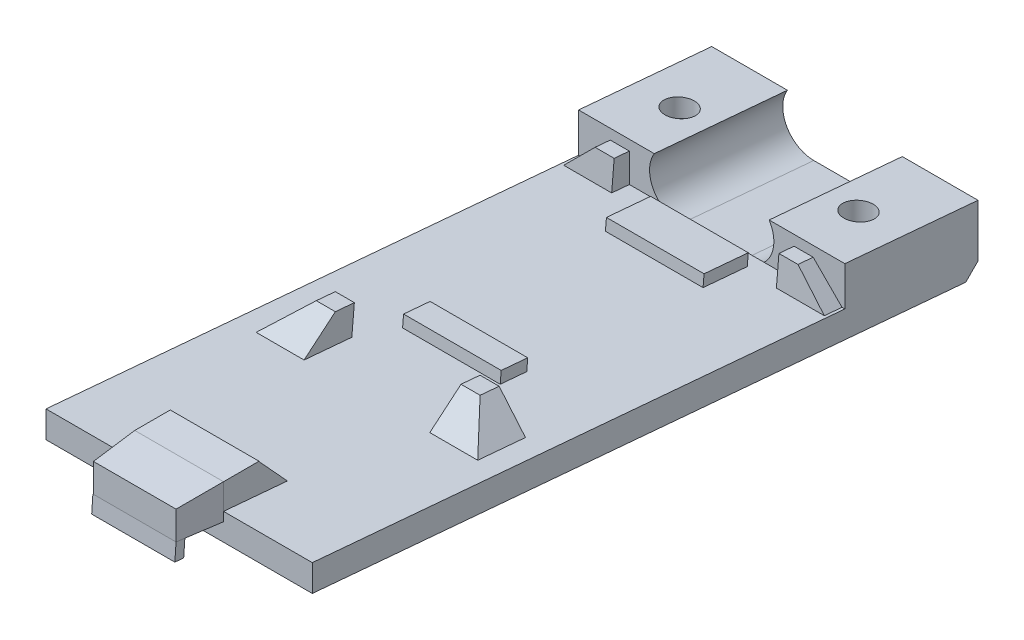
from build123d import *

# Parameters (mm, degrees)
BOSS_EXTRUDE2_DEPTH = 30
CUT_EXTRUDE1_REACH  = 197.235
CUT_EXTRUDE2_START  = 7
SKETCH6_R           = 2.85
CUT_EXTRUDE2_DEPTH  = 201.285862098
SKETCH7_R           = 1.65
CUT_EXTRUDE3_DEPTH  = 209.121088475
SKETCH9_W           = 10
SKETCH9_H           = 5.906967626
BOSS_EXTRUDE4_DEPTH = 4
SKETCH10_W          = 10
SKETCH10_H          = 3.906967626
BOSS_EXTRUDE5_DEPTH = 5
BOSS_EXTRUDE5_TAPER = 4
FILLET1_SIZE        = 3.5
CUT_EXTRUDE4_START  = -0.25
CUT_EXTRUDE4_DEPTH  = 0.25
SKETCH12_W          = 3.3
SKETCH12_H          = 3.3
CUT_EXTRUDE5_DEPTH  = 0.25
SKETCH13_W          = 2
SKETCH13_H          = 2
BOSS_EXTRUDE6_DEPTH = 3.25
BOSS_EXTRUDE7_REACH = 209.762
SKETCH14_W          = 9.370488354
SKETCH14_H          = 1
SKETCH17_W          = 11
SKETCH17_H          = 5
SKETCH17_H_2        = 3
BOSS_EXTRUDE8_DEPTH = 1.3


with BuildPart() as part:
    # Sketch2 → Boss-Extrude2 (new body)
    with BuildSketch(Plane(origin=(148.792269218, 0, 0), x_dir=(0, 0, -1), z_dir=(1, 0, 0))):
        Polygon((89.155083501, -18.22802064), (89.155083501, -22.644827925), (29.155083501, -17.395508114), (29.155083501, -20.406967626), (102.775758778, -26.847942114), (104.155083501, -25.468617391), (104.155083501, -19.540350593), align=None)
    extrude(amount=BOSS_EXTRUDE2_DEPTH)

    # Cut-Extrude1: up to this plane
    cut_extrude1_end = Plane(origin=(254.385579164, -18.22802064, -89.155083501), z_dir=(0, 0, -1))
    # Sketch4 → Cut-Extrude1 (cut, up to the surface)
    with BuildSketch(Plane(origin=(0, -9.236632985, -105.575198123), x_dir=(-1, 0, 0), z_dir=(0, -0.0871557427476512, -0.9961946980917462)), mode=Mode.PRIVATE) as cut_extrude1_sk1:
        with BuildLine():
            Line((-167.292269218, -8.738279996), (-160.292269218, -8.738279996))
            ThreePointArc((-160.292269218, -8.738279996), (-156.792269218, -12.238279996), (-160.292269218, -15.738279996))
            Line((-160.292269218, -15.738279996), (-167.292269218, -15.738279996))
            ThreePointArc((-167.292269218, -15.738279996), (-170.792269218, -12.238279996), (-167.292269218, -8.738279996))
        make_face()
    cut_extrude1_tool1 = split(extrude(cut_extrude1_sk1.sketch, amount=-CUT_EXTRUDE1_REACH, mode=Mode.PRIVATE), bisect_by=cut_extrude1_end, keep=Keep.BOTH, mode=Mode.PRIVATE)
    add(cut_extrude1_tool1.solids().sort_by_distance((163.792269, -21.428343, -104.508562))[0], mode=Mode.SUBTRACT)

    # Sketch6 → Cut-Extrude2 (cut, through all)
    with BuildSketch(Plane(origin=(0, -14.5, 0), x_dir=(-1, 0, 0), z_dir=(0, -1, 0)).offset(CUT_EXTRUDE2_START)):
        with Locations(Location((-173.869198237, 95.613531365, 0), (0, 0, 270))):
            Circle(SKETCH6_R)
        with Locations(Location((-153.7153402, 95.613531365, 0), (0, 0, 270))):
            Circle(SKETCH6_R)
    extrude(amount=CUT_EXTRUDE2_DEPTH, mode=Mode.SUBTRACT)

    # Sketch7 → Cut-Extrude3 (cut, through all)
    with BuildSketch(Plane(origin=(0, -4.5, 0), x_dir=(1, 0, 0), z_dir=(0, 1, 0))):
        with Locations(Location((173.869198237, 95.613531365, 0), (0, 0, 270))):
            Circle(SKETCH7_R)
        with Locations(Location((153.7153402, 95.613531365, 0), (0, 0, 270))):
            Circle(SKETCH7_R)
    extrude(amount=-CUT_EXTRUDE3_DEPTH, mode=Mode.SUBTRACT)

    # Sketch9 → Boss-Extrude4 (add)
    with BuildSketch(Plane.XY.offset(-29.155083501)):
        with Locations((163.792269218, -17.453483813)):
            Rectangle(SKETCH9_W, SKETCH9_H)
    extrude(amount=-BOSS_EXTRUDE4_DEPTH)

    # Sketch10 → Boss-Extrude5 (add)
    with BuildSketch(Plane.XY.offset(-29.155083501)):
        with Locations((163.792269218, -16.453483813)):
            Rectangle(SKETCH10_W, SKETCH10_H)
    extrude(amount=BOSS_EXTRUDE5_DEPTH, taper=BOSS_EXTRUDE5_TAPER)

    # Fillet1
    # the kernel refuses this chamfer: 3.5 mm, written as the material it adds along each edge
    with BuildSketch(Plane(origin=(158.792269218, -17.745462768, -33.155083501), x_dir=(0, -0.11557140669619721, -0.9932991744455757), z_dir=(1, 0, 0))) as fillet1_piece_1:
        Polygon((FILLET1_SIZE * 0.915957386947, FILLET1_SIZE * 0.0261703223739), (-FILLET1_SIZE * 0.105901682781, FILLET1_SIZE * 0.91019099867), (0, 0), align=None)
    extrude(amount=10)

    # Sketch11 → Cut-Extrude4 (cut)
    with BuildSketch(Plane.XZ.offset(21.5).offset(CUT_EXTRUDE4_START)):
        with BuildLine():
            Line((171.545408229, -97.263531365), (176.192988244, -97.263531365))
            ThreePointArc((176.192988244, -97.263531365), (176.719198237, -95.613531365), (176.192988244, -93.963531365))
            Line((176.192988244, -93.963531365), (171.545408229, -93.963531365))
            ThreePointArc((171.545408229, -93.963531365), (171.019198237, -95.613531365), (171.545408229, -97.263531365))
        make_face()
    cut_extrude4 = extrude(amount=CUT_EXTRUDE4_DEPTH, mode=Mode.SUBTRACT)

    # Sketch12 → Cut-Extrude5 (cut)
    with BuildSketch(Plane.XZ.offset(21.25)):
        with Locations((173.869198237, -95.613531365)):
            Rectangle(SKETCH12_W, SKETCH12_H)
    cut_extrude5 = extrude(amount=-CUT_EXTRUDE5_DEPTH, mode=Mode.SUBTRACT)

    # Mirror1: Cut-Extrude4, Cut-Extrude5 across plane
    add(cut_extrude4.mirror(Plane(origin=(163.792269218, 0, 0), x_dir=(0, 0, 1), z_dir=(1, 0, 0))), mode=Mode.SUBTRACT)
    add(cut_extrude5.mirror(Plane(origin=(163.792269218, 0, 0), x_dir=(0, 0, 1), z_dir=(1, 0, 0))), mode=Mode.SUBTRACT)

    # Sketch13 → Boss-Extrude6 (add)
    with BuildSketch(Plane(origin=(0, -14.732006126, 1.288883527), x_dir=(1, 0, 0), z_dir=(0, 0.9961946980917463, -0.08715574274765082))):
        with Locations((171.872269218, 56.19771425)):
            Rectangle(SKETCH13_W, SKETCH13_H)
        with Locations((174.072269218, 89.789448289)):
            Rectangle(SKETCH13_W, SKETCH13_H)
    boss_extrude6 = extrude(amount=BOSS_EXTRUDE6_DEPTH)

    # Chamfer1
    # the kernel refuses this chamfer: 3.4 mm, written as the material it adds along each edge
    with BuildSketch(Plane(origin=(170.872269218, -19.542803909, -53.698786756), x_dir=(0, 0.059731544136399986, 0.9982144772718343), z_dir=(1, 0, 0))) as chamfer1_piece_1_section:
        with BuildLine():
            Line((3.497488864, 0), (-0.192260327, -3.492200498))
            Line((-0.192260327, -3.492200498), (-0.260234617, -3.490330778))
            ThreePointArc((-0.260234617, -3.490330778), (-0.116039372, -1.745552621), (-0.06797429, 0.00186972))
            Line((-0.06797429, 0.00186972), (0.00186972, 0.06797429))
            ThreePointArc((0.00186972, 0.06797429), (1.74929206, 0.019909209), (3.499358583, 0.06797429))
            Line((3.499358583, 0.06797429), (3.497488864, 0))
        make_face()
    chamfer1_piece_1 = extrude(amount=2, mode=Mode.PRIVATE)
    chamfer1_piece_1 = split(chamfer1_piece_1, bisect_by=Plane(origin=(171.872269218, -16.206722557, -52.85677046), z_dir=(0, -0.9961946980917463, 0.08715574274765082)), keep=Keep.TOP, mode=Mode.PRIVATE)
    add(chamfer1_piece_1)
    with BuildSketch(Plane(origin=(172.872269218, -19.542803909, -53.698786756), x_dir=(0.999621916911297, -0.027391246498838125, 0.002396423548492289), z_dir=(0, -0.08715574274765082, -0.9961946980917463))) as chamfer1_piece_2_section:
        with BuildLine():
            Line((3.497488864, 0), (-0.192260327, -3.492200498))
            Line((-0.192260327, -3.492200498), (-0.260234617, -3.490330778))
            ThreePointArc((-0.260234617, -3.490330778), (-0.116039372, -1.745552621), (-0.06797429, 0.00186972))
            Line((-0.06797429, 0.00186972), (0.00186972, 0.06797429))
            ThreePointArc((0.00186972, 0.06797429), (1.74929206, 0.019909209), (3.499358583, 0.06797429))
            Line((3.499358583, 0.06797429), (3.497488864, 0))
        make_face()
    chamfer1_piece_2 = extrude(amount=2, mode=Mode.PRIVATE)
    chamfer1_piece_2 = split(chamfer1_piece_2, bisect_by=Plane(origin=(174.001840036, -16.392326883, -54.978237618), z_dir=(0, -0.9961946980917463, 0.08715574274765082)), keep=Keep.TOP, mode=Mode.PRIVATE)
    add(chamfer1_piece_2)
    with BuildSketch(Plane(origin=(175.072269218, -22.47051644, -87.162694105), x_dir=(0.9996219169112963, -0.027391246498863667, 0.0023964235484945228), z_dir=(0, -0.08715574274765082, -0.9961946980917463))) as chamfer1_piece_3_section:
        with BuildLine():
            Line((3.497488864, 0), (-0.192260327, -3.492200498))
            Line((-0.192260327, -3.492200498), (-0.260234617, -3.490330778))
            ThreePointArc((-0.260234617, -3.490330778), (-0.116039372, -1.745552621), (-0.06797429, 0.00186972))
            Line((-0.06797429, 0.00186972), (0.00186972, 0.06797429))
            ThreePointArc((0.00186972, 0.06797429), (1.74929206, 0.019909209), (3.499358583, 0.06797429))
            Line((3.499358583, 0.06797429), (3.497488864, 0))
        make_face()
    chamfer1_piece_3 = extrude(amount=10.743722159, mode=Mode.PRIVATE)
    chamfer1_piece_3 = split(chamfer1_piece_3, bisect_by=Plane(origin=(176.219153997, -21.484451045, -89.155083501), z_dir=(0, 0, 1)), keep=Keep.TOP, mode=Mode.PRIVATE)
    chamfer1_piece_3 = split(chamfer1_piece_3, bisect_by=Plane(origin=(176.219153997, -19.315947713, -88.395376614), z_dir=(0, -0.9961946980917463, 0.08715574274765082)), keep=Keep.TOP, mode=Mode.PRIVATE)
    add(chamfer1_piece_3)
    with BuildSketch(Plane(origin=(172.872269218, -18.78073831, -44.988337099), x_dir=(0.9996219169112966, -0.027391246498851222, 0.0023964235484934342), z_dir=(0, -0.08715574274765082, -0.9961946980917463))) as chamfer1_piece_4a_section:
        with BuildLine():
            Line((3.497488864, 0), (-0.192260327, -3.492200498))
            Line((-0.192260327, -3.492200498), (-0.260234617, -3.490330778))
            ThreePointArc((-0.260234617, -3.490330778), (-0.116039372, -1.745552621), (-0.06797429, 0.00186972))
            Line((-0.06797429, 0.00186972), (0.00186972, 0.06797429))
            ThreePointArc((0.00186972, 0.06797429), (1.74929206, 0.019909209), (3.499358583, 0.06797429))
            Line((3.499358583, 0.06797429), (3.497488864, 0))
        make_face()
    chamfer1_piece_4a = extrude(amount=10.743722159, mode=Mode.PRIVATE)
    chamfer1_piece_4a = split(chamfer1_piece_4a, bisect_by=Plane(origin=(174.001840036, -18.441436891, -53.795143884), z_dir=(0, 0.08715574274765084, 0.9961946980917462)), keep=Keep.TOP, mode=Mode.PRIVATE)
    chamfer1_piece_4a = split(chamfer1_piece_4a, bisect_by=Plane(origin=(174.001840036, -15.924138341, -49.626818091), z_dir=(0, -0.9961946980917463, 0.08715574274765082)), keep=Keep.TOP, mode=Mode.PRIVATE)
    with BuildSketch(Plane(origin=(170.872269218, -19.542803909, -53.698786756), x_dir=(0, 0.059731544136399986, 0.9982144772718343), z_dir=(1, 0, 0))) as chamfer1_piece_4b_section:
        with BuildLine():
            Line((3.497488864, 0), (-0.192260327, -3.492200498))
            Line((-0.192260327, -3.492200498), (-0.260234617, -3.490330778))
            ThreePointArc((-0.260234617, -3.490330778), (-0.116039372, -1.745552621), (-0.06797429, 0.00186972))
            Line((-0.06797429, 0.00186972), (0.00186972, 0.06797429))
            ThreePointArc((0.00186972, 0.06797429), (1.74929206, 0.019909209), (3.499358583, 0.06797429))
            Line((3.499358583, 0.06797429), (3.497488864, 0))
        make_face()
    chamfer1_piece_4b = extrude(amount=10.743722159, mode=Mode.PRIVATE)
    chamfer1_piece_4b = split(chamfer1_piece_4b, bisect_by=Plane(origin=(178.792269218, -18.342988307, -52.669871424), z_dir=(-1, 0, 0)), keep=Keep.TOP, mode=Mode.PRIVATE)
    chamfer1_piece_4b = split(chamfer1_piece_4b, bisect_by=Plane(origin=(172.872269218, -18.342988307, -52.669871424), z_dir=(1, 0, 0)), keep=Keep.TOP, mode=Mode.PRIVATE)
    chamfer1_piece_4b = split(chamfer1_piece_4b, bisect_by=Plane(origin=(175.832269218, -16.206722557, -52.85677046), z_dir=(0, -0.9961946980917463, 0.08715574274765082)), keep=Keep.TOP, mode=Mode.PRIVATE)
    chamfer1_piece_4 = chamfer1_piece_4a & chamfer1_piece_4b
    add(chamfer1_piece_4)

    # Mirror2: Boss-Extrude6 across plane
    add(boss_extrude6.mirror(Plane(origin=(163.792269218, 0, 0), x_dir=(0, 0, 1), z_dir=(1, 0, 0))))

    # Chamfer1 of Mirror2
    # the kernel refuses this chamfer: 3.4 mm, written as the material it adds along each edge
    with BuildSketch(Plane(origin=(156.712269218, -19.542803909, -53.698786756), x_dir=(0, 0.05973154413639897, 0.9982144772718343), z_dir=(-1, 0, 0))) as chamfer1_of_mirror2_piece_1_section:
        with BuildLine():
            Line((3.497488864, 0), (-0.192260327, 3.492200498))
            Line((-0.192260327, 3.492200498), (-0.260234617, 3.490330778))
            ThreePointArc((-0.260234617, 3.490330778), (-0.116039372, 1.745552621), (-0.06797429, -0.00186972))
            Line((-0.06797429, -0.00186972), (0.00186972, -0.06797429))
            ThreePointArc((0.00186972, -0.06797429), (1.74929206, -0.019909209), (3.499358583, -0.06797429))
            Line((3.499358583, -0.06797429), (3.497488864, 0))
        make_face()
    chamfer1_of_mirror2_piece_1 = extrude(amount=2, mode=Mode.PRIVATE)
    chamfer1_of_mirror2_piece_1 = split(chamfer1_of_mirror2_piece_1, bisect_by=Plane(origin=(155.712269218, -16.206722557, -52.85677046), z_dir=(0, -0.9961946980917463, 0.08715574274765082)), keep=Keep.TOP, mode=Mode.PRIVATE)
    add(chamfer1_of_mirror2_piece_1)
    with BuildSketch(Plane(origin=(154.712269218, -19.542803909, -53.698786756), x_dir=(-0.999621916911297, -0.027391246498838125, 0.002396423548492289), z_dir=(0, -0.08715574274765082, -0.9961946980917463))) as chamfer1_of_mirror2_piece_2_section:
        with BuildLine():
            Line((3.497488864, 0), (-0.192260327, 3.492200498))
            Line((-0.192260327, 3.492200498), (-0.260234617, 3.490330778))
            ThreePointArc((-0.260234617, 3.490330778), (-0.116039372, 1.745552621), (-0.06797429, -0.00186972))
            Line((-0.06797429, -0.00186972), (0.00186972, -0.06797429))
            ThreePointArc((0.00186972, -0.06797429), (1.74929206, -0.019909209), (3.499358583, -0.06797429))
            Line((3.499358583, -0.06797429), (3.497488864, 0))
        make_face()
    chamfer1_of_mirror2_piece_2 = extrude(amount=2, mode=Mode.PRIVATE)
    chamfer1_of_mirror2_piece_2 = split(chamfer1_of_mirror2_piece_2, bisect_by=Plane(origin=(153.582698401, -16.392326883, -54.978237618), z_dir=(0, -0.9961946980917463, 0.08715574274765082)), keep=Keep.TOP, mode=Mode.PRIVATE)
    add(chamfer1_of_mirror2_piece_2)
    with BuildSketch(Plane(origin=(152.512269218, -22.47051644, -87.162694105), x_dir=(-0.9996219169112963, -0.027391246498863667, 0.0023964235484945228), z_dir=(0, -0.08715574274765082, -0.9961946980917463))) as chamfer1_of_mirror2_piece_3_section:
        with BuildLine():
            Line((3.497488864, 0), (-0.192260327, 3.492200498))
            Line((-0.192260327, 3.492200498), (-0.260234617, 3.490330778))
            ThreePointArc((-0.260234617, 3.490330778), (-0.116039372, 1.745552621), (-0.06797429, -0.00186972))
            Line((-0.06797429, -0.00186972), (0.00186972, -0.06797429))
            ThreePointArc((0.00186972, -0.06797429), (1.74929206, -0.019909209), (3.499358583, -0.06797429))
            Line((3.499358583, -0.06797429), (3.497488864, 0))
        make_face()
    chamfer1_of_mirror2_piece_3 = extrude(amount=10.743722159, mode=Mode.PRIVATE)
    chamfer1_of_mirror2_piece_3 = split(chamfer1_of_mirror2_piece_3, bisect_by=Plane(origin=(151.365384439, -21.484451045, -89.155083501), z_dir=(0, 0, 1)), keep=Keep.TOP, mode=Mode.PRIVATE)
    chamfer1_of_mirror2_piece_3 = split(chamfer1_of_mirror2_piece_3, bisect_by=Plane(origin=(151.365384439, -19.315947713, -88.395376614), z_dir=(0, -0.9961946980917463, 0.08715574274765082)), keep=Keep.TOP, mode=Mode.PRIVATE)
    add(chamfer1_of_mirror2_piece_3)
    with BuildSketch(Plane(origin=(156.712269218, -19.542803909, -53.698786756), x_dir=(0, 0.05973154413639897, 0.9982144772718343), z_dir=(-1, 0, 0))) as chamfer1_of_mirror2_piece_4a_section:
        with BuildLine():
            Line((3.497488864, 0), (-0.192260327, 3.492200498))
            Line((-0.192260327, 3.492200498), (-0.260234617, 3.490330778))
            ThreePointArc((-0.260234617, 3.490330778), (-0.116039372, 1.745552621), (-0.06797429, -0.00186972))
            Line((-0.06797429, -0.00186972), (0.00186972, -0.06797429))
            ThreePointArc((0.00186972, -0.06797429), (1.74929206, -0.019909209), (3.499358583, -0.06797429))
            Line((3.499358583, -0.06797429), (3.497488864, 0))
        make_face()
    chamfer1_of_mirror2_piece_4a = extrude(amount=10.743722159, mode=Mode.PRIVATE)
    chamfer1_of_mirror2_piece_4a = split(chamfer1_of_mirror2_piece_4a, bisect_by=Plane(origin=(148.792269218, -18.342988307, -52.669871424), z_dir=(1, 0, 0)), keep=Keep.TOP, mode=Mode.PRIVATE)
    chamfer1_of_mirror2_piece_4a = split(chamfer1_of_mirror2_piece_4a, bisect_by=Plane(origin=(154.712269218, -18.342988307, -52.669871424), z_dir=(-1, 0, 0)), keep=Keep.TOP, mode=Mode.PRIVATE)
    chamfer1_of_mirror2_piece_4a = split(chamfer1_of_mirror2_piece_4a, bisect_by=Plane(origin=(151.752269218, -16.206722557, -52.85677046), z_dir=(0, -0.9961946980917463, 0.08715574274765082)), keep=Keep.TOP, mode=Mode.PRIVATE)
    with BuildSketch(Plane(origin=(154.712269218, -18.78073831, -44.988337099), x_dir=(-0.9996219169112966, -0.027391246498851222, 0.0023964235484934342), z_dir=(0, -0.08715574274765082, -0.9961946980917463))) as chamfer1_of_mirror2_piece_4b_section:
        with BuildLine():
            Line((3.497488864, 0), (-0.192260327, 3.492200498))
            Line((-0.192260327, 3.492200498), (-0.260234617, 3.490330778))
            ThreePointArc((-0.260234617, 3.490330778), (-0.116039372, 1.745552621), (-0.06797429, -0.00186972))
            Line((-0.06797429, -0.00186972), (0.00186972, -0.06797429))
            ThreePointArc((0.00186972, -0.06797429), (1.74929206, -0.019909209), (3.499358583, -0.06797429))
            Line((3.499358583, -0.06797429), (3.497488864, 0))
        make_face()
    chamfer1_of_mirror2_piece_4b = extrude(amount=10.743722159, mode=Mode.PRIVATE)
    chamfer1_of_mirror2_piece_4b = split(chamfer1_of_mirror2_piece_4b, bisect_by=Plane(origin=(153.582698401, -18.441436891, -53.795143884), z_dir=(0, 0.08715574274765084, 0.9961946980917462)), keep=Keep.TOP, mode=Mode.PRIVATE)
    chamfer1_of_mirror2_piece_4b = split(chamfer1_of_mirror2_piece_4b, bisect_by=Plane(origin=(153.582698401, -15.924138341, -49.626818091), z_dir=(0, -0.9961946980917463, 0.08715574274765082)), keep=Keep.TOP, mode=Mode.PRIVATE)
    chamfer1_of_mirror2_piece_4 = chamfer1_of_mirror2_piece_4a & chamfer1_of_mirror2_piece_4b
    add(chamfer1_of_mirror2_piece_4)

    # Boss-Extrude7: up to this plane
    boss_extrude7_end = Plane(origin=(254.385579164, -17.72059022, 1.550350755), z_dir=(0, 0.9961946980917462, -0.08715574274765119))
    # Sketch14 → Boss-Extrude7 (add, up to the surface)
    with BuildSketch(Plane(origin=(0, -16.288598265, 1.139009748), x_dir=(1, 0, 0), z_dir=(0, -0.9975640502598242, 0.06975647374412541)), mode=Mode.PRIVATE) as boss_extrude7_sk1:
        with Locations((163.757390981, -25.855858847)):
            Rectangle(SKETCH14_W, SKETCH14_H)
    boss_extrude7_tool1 = split(extrude(boss_extrude7_sk1.sketch, amount=BOSS_EXTRUDE7_REACH, mode=Mode.PRIVATE), bisect_by=boss_extrude7_end, keep=Keep.BOTH, mode=Mode.PRIVATE)
    add(boss_extrude7_tool1.solids().sort_by_distance((163.757391, -18.092212, -24.653866))[0])

    # Sketch17 → Boss-Extrude8 (add)
    with BuildSketch(Plane(origin=(0, -14.732006126, 1.288883527), x_dir=(1, 0, 0), z_dir=(0, 0.9961946980917461, -0.08715574274765119))):
        with Locations((163.792269218, 86.789448289)):
            Rectangle(SKETCH17_W, SKETCH17_H)
        with Locations((163.792269218, 62.84771425)):
            Rectangle(SKETCH17_W, SKETCH17_H_2)
    extrude(amount=BOSS_EXTRUDE8_DEPTH)


solid = part.part
